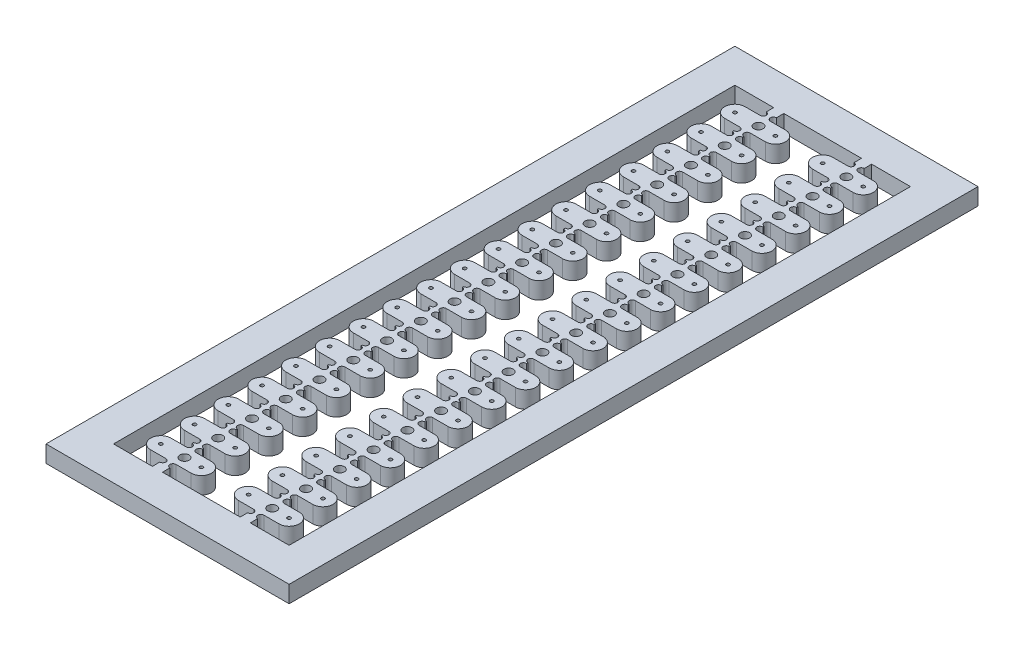
from build123d import *

# Parameters (mm, degrees)
SKETCH1_R             = 0.6825
SKETCH1_R_2           = 0.255
BOSS_EXTRUDE1_DEPTH   = 2.5
SKETCH2_R             = 0.45
CUT_EXTRUDE1_DEPTH    = 6.722761571
LPATTERN1_COUNT       = 18
LPATTERN1_PITCH       = 5
BOSS_EXTRUDE2_DEPTH   = 2.5
LPATTERN2_OUTLINE_R   = 0.255
LPATTERN2_OUTLINE_R_2 = 0.6825
LPATTERN2_DEPTH       = 2.5


# Read off the part's stored shape, not the designer's step: LPattern2
with BuildPart() as part:
    # Sketch1 → Boss-Extrude1 (new body)
    with BuildSketch(Plane(origin=(0, 0, 0), x_dir=(1, 0, 0), z_dir=(0, 1, 0))):
        with BuildLine():
            Line((-0.75, -1.5), (-0.75, -2.5))
            Line((-0.75, -2.5), (0.75, -2.5))
            Line((0.75, -2.5), (0.75, -1.5))
            Line((0.75, -1.5), (3, -1.5))
            ThreePointArc((3, -1.5), (4.5, 0), (3, 1.5))
            Line((3, 1.5), (0.75, 1.5))
            Line((0.75, 1.5), (0.75, 2.5))
            Line((0.75, 2.5), (-0.75, 2.5))
            Line((-0.75, 2.5), (-0.75, 1.5))
            Line((-0.75, 1.5), (-2.745, 1.5))
            Line((-2.745, 1.5), (-3, 1.5))
            ThreePointArc((-3, 1.5), (-4.5, 0), (-3, -1.5))
            Line((-3, -1.5), (-0.75, -1.5))
        make_face()
        with Locations(Location((0.5, 0, 0), (0, 0, 270))):
            Circle(SKETCH1_R, mode=Mode.SUBTRACT)
        with Locations(Location((3, 0, 0), (0, 0, 270))):
            Circle(SKETCH1_R_2, mode=Mode.SUBTRACT)
        with Locations(Location((-3, 0, 0), (0, 0, 270))):
            Circle(SKETCH1_R_2, mode=Mode.SUBTRACT)
    extrude(amount=BOSS_EXTRUDE1_DEPTH)

    # Sketch2 → Cut-Extrude1 (cut, through all)
    with BuildSketch(Plane(origin=(0, 2.5, 0), x_dir=(1, 0, 0), z_dir=(0, 1, 0))):
        with Locations((-0.75, 1.95)):
            Circle(SKETCH2_R)
        with Locations((0.75, 1.95)):
            Circle(SKETCH2_R)
        with Locations((-0.75, -1.95)):
            Circle(SKETCH2_R)
        with Locations((0.75, -1.95)):
            Circle(SKETCH2_R)
    extrude(amount=-CUT_EXTRUDE1_DEPTH, mode=Mode.SUBTRACT)

    # LPattern1: part ×18


with BuildPart() as part_1:
    add(part.part)
    with Locations(*[(0, 0, i * LPATTERN1_PITCH) for i in range(1, LPATTERN1_COUNT)]):
        add(part.part)

    # Sketch5 → Boss-Extrude2 (add)
    with BuildSketch(Plane(origin=(0, 0, 0), x_dir=(1, 0, 0), z_dir=(0, 1, 0))):
        Polygon((-0.75, 2.5), (-0.75, 3.5), (-6.5, 3.5), (-6.5, -88.5), (-0.75, -88.5), (-0.75, -87.5), (0.75, -87.5), (0.75, -88.5), (6.5, -88.5), (6.5, -93.5), (-6.5, -93.5), (-11.5, -93.5), (-11.5, 8.5), (-6.5, 8.5), (6.5, 8.5), (6.5, 3.5), (0.75, 3.5), (0.75, 2.5), align=None)
    boss_extrude2 = extrude(amount=BOSS_EXTRUDE2_DEPTH)

    # Mirror1: Boss-Extrude2 across plane
    add(boss_extrude2.mirror(Plane(origin=(6.5, 106.07605901, -8.5), x_dir=(0, 0, 1), z_dir=(-1, 0, 0))))

    # LPattern2 outline → LPattern2 (add)
    with BuildSketch(Plane(origin=(0, 0, 0), x_dir=(1, 0, 0), z_dir=(0, 1, 0))):
        with BuildLine():
            Line((10, -1.5), (12.25, -1.5))
            ThreePointArc((12.25, -1.5), (12.7, -1.95), (12.25, -2.4))
            Line((12.25, -2.4), (12.25, -2.6))
            ThreePointArc((12.25, -2.6), (12.7, -3.05), (12.25, -3.5))
            Line((12.25, -3.5), (10, -3.5))
            ThreePointArc((10, -3.5), (8.5, -5), (10, -6.5))
            Line((10, -6.5), (12.25, -6.5))
            ThreePointArc((12.25, -6.5), (12.7, -6.95), (12.25, -7.4))
            Line((12.25, -7.4), (12.25, -7.6))
            ThreePointArc((12.25, -7.6), (12.7, -8.05), (12.25, -8.5))
            Line((12.25, -8.5), (10, -8.5))
            ThreePointArc((10, -8.5), (8.5, -10), (10, -11.5))
            Line((10, -11.5), (12.25, -11.5))
            ThreePointArc((12.25, -11.5), (12.7, -11.95), (12.25, -12.4))
            Line((12.25, -12.4), (12.25, -12.6))
            ThreePointArc((12.25, -12.6), (12.7, -13.05), (12.25, -13.5))
            Line((12.25, -13.5), (10, -13.5))
            ThreePointArc((10, -13.5), (8.5, -15), (10, -16.5))
            Line((10, -16.5), (12.25, -16.5))
            ThreePointArc((12.25, -16.5), (12.7, -16.95), (12.25, -17.4))
            Line((12.25, -17.4), (12.25, -17.6))
            ThreePointArc((12.25, -17.6), (12.7, -18.05), (12.25, -18.5))
            Line((12.25, -18.5), (10, -18.5))
            ThreePointArc((10, -18.5), (8.5, -20), (10, -21.5))
            Line((10, -21.5), (12.25, -21.5))
            ThreePointArc((12.25, -21.5), (12.7, -21.95), (12.25, -22.4))
            Line((12.25, -22.4), (12.25, -22.6))
            ThreePointArc((12.25, -22.6), (12.7, -23.05), (12.25, -23.5))
            Line((12.25, -23.5), (10, -23.5))
            ThreePointArc((10, -23.5), (8.5, -25), (10, -26.5))
            Line((10, -26.5), (12.25, -26.5))
            ThreePointArc((12.25, -26.5), (12.7, -26.95), (12.25, -27.4))
            Line((12.25, -27.4), (12.25, -27.6))
            ThreePointArc((12.25, -27.6), (12.7, -28.05), (12.25, -28.5))
            Line((12.25, -28.5), (10, -28.5))
            ThreePointArc((10, -28.5), (8.5, -30), (10, -31.5))
            Line((10, -31.5), (12.25, -31.5))
            ThreePointArc((12.25, -31.5), (12.7, -31.95), (12.25, -32.4))
            Line((12.25, -32.4), (12.25, -32.6))
            ThreePointArc((12.25, -32.6), (12.7, -33.05), (12.25, -33.5))
            Line((12.25, -33.5), (10, -33.5))
            ThreePointArc((10, -33.5), (8.5, -35), (10, -36.5))
            Line((10, -36.5), (12.25, -36.5))
            ThreePointArc((12.25, -36.5), (12.7, -36.95), (12.25, -37.4))
            Line((12.25, -37.4), (12.25, -37.6))
            ThreePointArc((12.25, -37.6), (12.7, -38.05), (12.25, -38.5))
            Line((12.25, -38.5), (10, -38.5))
            ThreePointArc((10, -38.5), (8.5, -40), (10, -41.5))
            Line((10, -41.5), (12.25, -41.5))
            ThreePointArc((12.25, -41.5), (12.7, -41.95), (12.25, -42.4))
            Line((12.25, -42.4), (12.25, -42.6))
            ThreePointArc((12.25, -42.6), (12.7, -43.05), (12.25, -43.5))
            Line((12.25, -43.5), (10, -43.5))
            ThreePointArc((10, -43.5), (8.5, -45), (10, -46.5))
            Line((10, -46.5), (12.25, -46.5))
            ThreePointArc((12.25, -46.5), (12.7, -46.95), (12.25, -47.4))
            Line((12.25, -47.4), (12.25, -47.6))
            ThreePointArc((12.25, -47.6), (12.7, -48.05), (12.25, -48.5))
            Line((12.25, -48.5), (10, -48.5))
            ThreePointArc((10, -48.5), (8.5, -50), (10, -51.5))
            Line((10, -51.5), (12.25, -51.5))
            ThreePointArc((12.25, -51.5), (12.7, -51.95), (12.25, -52.4))
            Line((12.25, -52.4), (12.25, -52.6))
            ThreePointArc((12.25, -52.6), (12.7, -53.05), (12.25, -53.5))
            Line((12.25, -53.5), (10, -53.5))
            ThreePointArc((10, -53.5), (8.5, -55), (10, -56.5))
            Line((10, -56.5), (12.25, -56.5))
            ThreePointArc((12.25, -56.5), (12.7, -56.95), (12.25, -57.4))
            Line((12.25, -57.4), (12.25, -57.6))
            ThreePointArc((12.25, -57.6), (12.7, -58.05), (12.25, -58.5))
            Line((12.25, -58.5), (10, -58.5))
            ThreePointArc((10, -58.5), (8.5, -60), (10, -61.5))
            Line((10, -61.5), (12.25, -61.5))
            ThreePointArc((12.25, -61.5), (12.7, -61.95), (12.25, -62.4))
            Line((12.25, -62.4), (12.25, -62.6))
            ThreePointArc((12.25, -62.6), (12.7, -63.05), (12.25, -63.5))
            Line((12.25, -63.5), (10, -63.5))
            ThreePointArc((10, -63.5), (8.5, -65), (10, -66.5))
            Line((10, -66.5), (12.25, -66.5))
            ThreePointArc((12.25, -66.5), (12.7, -66.95), (12.25, -67.4))
            Line((12.25, -67.4), (12.25, -67.6))
            ThreePointArc((12.25, -67.6), (12.7, -68.05), (12.25, -68.5))
            Line((12.25, -68.5), (10, -68.5))
            ThreePointArc((10, -68.5), (8.5, -70), (10, -71.5))
            Line((10, -71.5), (12.25, -71.5))
            ThreePointArc((12.25, -71.5), (12.7, -71.95), (12.25, -72.4))
            Line((12.25, -72.4), (12.25, -72.6))
            ThreePointArc((12.25, -72.6), (12.7, -73.05), (12.25, -73.5))
            Line((12.25, -73.5), (10, -73.5))
            ThreePointArc((10, -73.5), (8.5, -75), (10, -76.5))
            Line((10, -76.5), (12.25, -76.5))
            ThreePointArc((12.25, -76.5), (12.7, -76.95), (12.25, -77.4))
            Line((12.25, -77.4), (12.25, -77.6))
            ThreePointArc((12.25, -77.6), (12.7, -78.05), (12.25, -78.5))
            Line((12.25, -78.5), (10, -78.5))
            ThreePointArc((10, -78.5), (8.5, -80), (10, -81.5))
            Line((10, -81.5), (12.25, -81.5))
            ThreePointArc((12.25, -81.5), (12.7, -81.95), (12.25, -82.4))
            Line((12.25, -82.4), (12.25, -82.6))
            ThreePointArc((12.25, -82.6), (12.7, -83.05), (12.25, -83.5))
            Line((12.25, -83.5), (10, -83.5))
            ThreePointArc((10, -83.5), (8.5, -85), (10, -86.5))
            Line((10, -86.5), (12.25, -86.5))
            ThreePointArc((12.25, -86.5), (12.7, -86.95), (12.25, -87.4))
            Line((12.25, -87.4), (12.25, -87.5))
            Line((12.25, -87.5), (13.75, -87.5))
            Line((13.75, -87.5), (13.75, -87.4))
            ThreePointArc((13.75, -87.4), (13.3, -86.95), (13.75, -86.5))
            Line((13.75, -86.5), (16, -86.5))
            ThreePointArc((16, -86.5), (17.5, -85), (16, -83.5))
            Line((16, -83.5), (13.75, -83.5))
            ThreePointArc((13.75, -83.5), (13.3, -83.05), (13.75, -82.6))
            Line((13.75, -82.6), (13.75, -82.4))
            ThreePointArc((13.75, -82.4), (13.3, -81.95), (13.75, -81.5))
            Line((13.75, -81.5), (16, -81.5))
            ThreePointArc((16, -81.5), (17.5, -80), (16, -78.5))
            Line((16, -78.5), (13.75, -78.5))
            ThreePointArc((13.75, -78.5), (13.3, -78.05), (13.75, -77.6))
            Line((13.75, -77.6), (13.75, -77.4))
            ThreePointArc((13.75, -77.4), (13.3, -76.95), (13.75, -76.5))
            Line((13.75, -76.5), (16, -76.5))
            ThreePointArc((16, -76.5), (17.5, -75), (16, -73.5))
            Line((16, -73.5), (13.75, -73.5))
            ThreePointArc((13.75, -73.5), (13.3, -73.05), (13.75, -72.6))
            Line((13.75, -72.6), (13.75, -72.4))
            ThreePointArc((13.75, -72.4), (13.3, -71.95), (13.75, -71.5))
            Line((13.75, -71.5), (16, -71.5))
            ThreePointArc((16, -71.5), (17.5, -70), (16, -68.5))
            Line((16, -68.5), (13.75, -68.5))
            ThreePointArc((13.75, -68.5), (13.3, -68.05), (13.75, -67.6))
            Line((13.75, -67.6), (13.75, -67.4))
            ThreePointArc((13.75, -67.4), (13.3, -66.95), (13.75, -66.5))
            Line((13.75, -66.5), (16, -66.5))
            ThreePointArc((16, -66.5), (17.5, -65), (16, -63.5))
            Line((16, -63.5), (13.75, -63.5))
            ThreePointArc((13.75, -63.5), (13.3, -63.05), (13.75, -62.6))
            Line((13.75, -62.6), (13.75, -62.4))
            ThreePointArc((13.75, -62.4), (13.3, -61.95), (13.75, -61.5))
            Line((13.75, -61.5), (16, -61.5))
            ThreePointArc((16, -61.5), (17.5, -60), (16, -58.5))
            Line((16, -58.5), (13.75, -58.5))
            ThreePointArc((13.75, -58.5), (13.3, -58.05), (13.75, -57.6))
            Line((13.75, -57.6), (13.75, -57.4))
            ThreePointArc((13.75, -57.4), (13.3, -56.95), (13.75, -56.5))
            Line((13.75, -56.5), (16, -56.5))
            ThreePointArc((16, -56.5), (17.5, -55), (16, -53.5))
            Line((16, -53.5), (13.75, -53.5))
            ThreePointArc((13.75, -53.5), (13.3, -53.05), (13.75, -52.6))
            Line((13.75, -52.6), (13.75, -52.4))
            ThreePointArc((13.75, -52.4), (13.3, -51.95), (13.75, -51.5))
            Line((13.75, -51.5), (16, -51.5))
            ThreePointArc((16, -51.5), (17.5, -50), (16, -48.5))
            Line((16, -48.5), (13.75, -48.5))
            ThreePointArc((13.75, -48.5), (13.3, -48.05), (13.75, -47.6))
            Line((13.75, -47.6), (13.75, -47.4))
            ThreePointArc((13.75, -47.4), (13.3, -46.95), (13.75, -46.5))
            Line((13.75, -46.5), (16, -46.5))
            ThreePointArc((16, -46.5), (17.5, -45), (16, -43.5))
            Line((16, -43.5), (13.75, -43.5))
            ThreePointArc((13.75, -43.5), (13.3, -43.05), (13.75, -42.6))
            Line((13.75, -42.6), (13.75, -42.4))
            ThreePointArc((13.75, -42.4), (13.3, -41.95), (13.75, -41.5))
            Line((13.75, -41.5), (16, -41.5))
            ThreePointArc((16, -41.5), (17.5, -40), (16, -38.5))
            Line((16, -38.5), (13.75, -38.5))
            ThreePointArc((13.75, -38.5), (13.3, -38.05), (13.75, -37.6))
            Line((13.75, -37.6), (13.75, -37.4))
            ThreePointArc((13.75, -37.4), (13.3, -36.95), (13.75, -36.5))
            Line((13.75, -36.5), (16, -36.5))
            ThreePointArc((16, -36.5), (17.5, -35), (16, -33.5))
            Line((16, -33.5), (13.75, -33.5))
            ThreePointArc((13.75, -33.5), (13.3, -33.05), (13.75, -32.6))
            Line((13.75, -32.6), (13.75, -32.4))
            ThreePointArc((13.75, -32.4), (13.3, -31.95), (13.75, -31.5))
            Line((13.75, -31.5), (16, -31.5))
            ThreePointArc((16, -31.5), (17.5, -30), (16, -28.5))
            Line((16, -28.5), (13.75, -28.5))
            ThreePointArc((13.75, -28.5), (13.3, -28.05), (13.75, -27.6))
            Line((13.75, -27.6), (13.75, -27.4))
            ThreePointArc((13.75, -27.4), (13.3, -26.95), (13.75, -26.5))
            Line((13.75, -26.5), (16, -26.5))
            ThreePointArc((16, -26.5), (17.5, -25), (16, -23.5))
            Line((16, -23.5), (13.75, -23.5))
            ThreePointArc((13.75, -23.5), (13.3, -23.05), (13.75, -22.6))
            Line((13.75, -22.6), (13.75, -22.4))
            ThreePointArc((13.75, -22.4), (13.3, -21.95), (13.75, -21.5))
            Line((13.75, -21.5), (16, -21.5))
            ThreePointArc((16, -21.5), (17.5, -20), (16, -18.5))
            Line((16, -18.5), (13.75, -18.5))
            ThreePointArc((13.75, -18.5), (13.3, -18.05), (13.75, -17.6))
            Line((13.75, -17.6), (13.75, -17.4))
            ThreePointArc((13.75, -17.4), (13.3, -16.95), (13.75, -16.5))
            Line((13.75, -16.5), (16, -16.5))
            ThreePointArc((16, -16.5), (17.5, -15), (16, -13.5))
            Line((16, -13.5), (13.75, -13.5))
            ThreePointArc((13.75, -13.5), (13.3, -13.05), (13.75, -12.6))
            Line((13.75, -12.6), (13.75, -12.4))
            ThreePointArc((13.75, -12.4), (13.3, -11.95), (13.75, -11.5))
            Line((13.75, -11.5), (16, -11.5))
            ThreePointArc((16, -11.5), (17.5, -10), (16, -8.5))
            Line((16, -8.5), (13.75, -8.5))
            ThreePointArc((13.75, -8.5), (13.3, -8.05), (13.75, -7.6))
            Line((13.75, -7.6), (13.75, -7.4))
            ThreePointArc((13.75, -7.4), (13.3, -6.95), (13.75, -6.5))
            Line((13.75, -6.5), (16, -6.5))
            ThreePointArc((16, -6.5), (17.5, -5), (16, -3.5))
            Line((16, -3.5), (13.75, -3.5))
            ThreePointArc((13.75, -3.5), (13.3, -3.05), (13.75, -2.6))
            Line((13.75, -2.6), (13.75, -2.4))
            ThreePointArc((13.75, -2.4), (13.3, -1.95), (13.75, -1.5))
            Line((13.75, -1.5), (16, -1.5))
            ThreePointArc((16, -1.5), (17.5, 0), (16, 1.5))
            Line((16, 1.5), (13.75, 1.5))
            ThreePointArc((13.75, 1.5), (13.3, 1.95), (13.75, 2.4))
            Line((13.75, 2.4), (13.75, 2.5))
            Line((13.75, 2.5), (12.25, 2.5))
            Line((12.25, 2.5), (12.25, 2.4))
            ThreePointArc((12.25, 2.4), (12.7, 1.95), (12.25, 1.5))
            Line((12.25, 1.5), (10, 1.5))
            ThreePointArc((10, 1.5), (8.5, 0), (10, -1.5))
        make_face()
        with Locations((10, -85)):
            Circle(LPATTERN2_OUTLINE_R, mode=Mode.SUBTRACT)
        with Locations((10, -80)):
            Circle(LPATTERN2_OUTLINE_R, mode=Mode.SUBTRACT)
        with Locations((10, -75)):
            Circle(LPATTERN2_OUTLINE_R, mode=Mode.SUBTRACT)
        with Locations((10, -70)):
            Circle(LPATTERN2_OUTLINE_R, mode=Mode.SUBTRACT)
        with Locations((10, -65)):
            Circle(LPATTERN2_OUTLINE_R, mode=Mode.SUBTRACT)
        with Locations((10, -60)):
            Circle(LPATTERN2_OUTLINE_R, mode=Mode.SUBTRACT)
        with Locations((10, -55)):
            Circle(LPATTERN2_OUTLINE_R, mode=Mode.SUBTRACT)
        with Locations((10, -50)):
            Circle(LPATTERN2_OUTLINE_R, mode=Mode.SUBTRACT)
        with Locations((10, -45)):
            Circle(LPATTERN2_OUTLINE_R, mode=Mode.SUBTRACT)
        with Locations((13.5, -85)):
            Circle(LPATTERN2_OUTLINE_R_2, mode=Mode.SUBTRACT)
        with Locations((13.5, -80)):
            Circle(LPATTERN2_OUTLINE_R_2, mode=Mode.SUBTRACT)
        with Locations((13.5, -75)):
            Circle(LPATTERN2_OUTLINE_R_2, mode=Mode.SUBTRACT)
        with Locations((13.5, -70)):
            Circle(LPATTERN2_OUTLINE_R_2, mode=Mode.SUBTRACT)
        with Locations((16, -85)):
            Circle(LPATTERN2_OUTLINE_R, mode=Mode.SUBTRACT)
        with Locations((16, -80)):
            Circle(LPATTERN2_OUTLINE_R, mode=Mode.SUBTRACT)
        with Locations((16, -75)):
            Circle(LPATTERN2_OUTLINE_R, mode=Mode.SUBTRACT)
        with Locations((16, -70)):
            Circle(LPATTERN2_OUTLINE_R, mode=Mode.SUBTRACT)
        with Locations((13.5, -65)):
            Circle(LPATTERN2_OUTLINE_R_2, mode=Mode.SUBTRACT)
        with Locations((13.5, -60)):
            Circle(LPATTERN2_OUTLINE_R_2, mode=Mode.SUBTRACT)
        with Locations((13.5, -55)):
            Circle(LPATTERN2_OUTLINE_R_2, mode=Mode.SUBTRACT)
        with Locations((13.5, -50)):
            Circle(LPATTERN2_OUTLINE_R_2, mode=Mode.SUBTRACT)
        with Locations((13.5, -45)):
            Circle(LPATTERN2_OUTLINE_R_2, mode=Mode.SUBTRACT)
        with Locations((16, -65)):
            Circle(LPATTERN2_OUTLINE_R, mode=Mode.SUBTRACT)
        with Locations((16, -60)):
            Circle(LPATTERN2_OUTLINE_R, mode=Mode.SUBTRACT)
        with Locations((16, -55)):
            Circle(LPATTERN2_OUTLINE_R, mode=Mode.SUBTRACT)
        with Locations((16, -50)):
            Circle(LPATTERN2_OUTLINE_R, mode=Mode.SUBTRACT)
        with Locations((16, -45)):
            Circle(LPATTERN2_OUTLINE_R, mode=Mode.SUBTRACT)
        with Locations((10, -40)):
            Circle(LPATTERN2_OUTLINE_R, mode=Mode.SUBTRACT)
        with Locations((10, -35)):
            Circle(LPATTERN2_OUTLINE_R, mode=Mode.SUBTRACT)
        with Locations((10, -30)):
            Circle(LPATTERN2_OUTLINE_R, mode=Mode.SUBTRACT)
        with Locations((10, -25)):
            Circle(LPATTERN2_OUTLINE_R, mode=Mode.SUBTRACT)
        with Locations((10, -20)):
            Circle(LPATTERN2_OUTLINE_R, mode=Mode.SUBTRACT)
        with Locations((10, -15)):
            Circle(LPATTERN2_OUTLINE_R, mode=Mode.SUBTRACT)
        with Locations((10, -10)):
            Circle(LPATTERN2_OUTLINE_R, mode=Mode.SUBTRACT)
        with Locations((10, -5)):
            Circle(LPATTERN2_OUTLINE_R, mode=Mode.SUBTRACT)
        with Locations((10, 0)):
            Circle(LPATTERN2_OUTLINE_R, mode=Mode.SUBTRACT)
        with Locations((13.5, -40)):
            Circle(LPATTERN2_OUTLINE_R_2, mode=Mode.SUBTRACT)
        with Locations((13.5, -35)):
            Circle(LPATTERN2_OUTLINE_R_2, mode=Mode.SUBTRACT)
        with Locations((13.5, -30)):
            Circle(LPATTERN2_OUTLINE_R_2, mode=Mode.SUBTRACT)
        with Locations((13.5, -25)):
            Circle(LPATTERN2_OUTLINE_R_2, mode=Mode.SUBTRACT)
        with Locations((16, -40)):
            Circle(LPATTERN2_OUTLINE_R, mode=Mode.SUBTRACT)
        with Locations((16, -35)):
            Circle(LPATTERN2_OUTLINE_R, mode=Mode.SUBTRACT)
        with Locations((16, -30)):
            Circle(LPATTERN2_OUTLINE_R, mode=Mode.SUBTRACT)
        with Locations((16, -25)):
            Circle(LPATTERN2_OUTLINE_R, mode=Mode.SUBTRACT)
        with Locations((13.5, -20)):
            Circle(LPATTERN2_OUTLINE_R_2, mode=Mode.SUBTRACT)
        with Locations((13.5, -15)):
            Circle(LPATTERN2_OUTLINE_R_2, mode=Mode.SUBTRACT)
        with Locations((13.5, -10)):
            Circle(LPATTERN2_OUTLINE_R_2, mode=Mode.SUBTRACT)
        with Locations((13.5, -5)):
            Circle(LPATTERN2_OUTLINE_R_2, mode=Mode.SUBTRACT)
        with Locations((13.5, 0)):
            Circle(LPATTERN2_OUTLINE_R_2, mode=Mode.SUBTRACT)
        with Locations((16, -20)):
            Circle(LPATTERN2_OUTLINE_R, mode=Mode.SUBTRACT)
        with Locations((16, -15)):
            Circle(LPATTERN2_OUTLINE_R, mode=Mode.SUBTRACT)
        with Locations((16, -10)):
            Circle(LPATTERN2_OUTLINE_R, mode=Mode.SUBTRACT)
        with Locations((16, -5)):
            Circle(LPATTERN2_OUTLINE_R, mode=Mode.SUBTRACT)
        with Locations((16, 0)):
            Circle(LPATTERN2_OUTLINE_R, mode=Mode.SUBTRACT)
    extrude(amount=LPATTERN2_DEPTH)


solid = part_1.part
